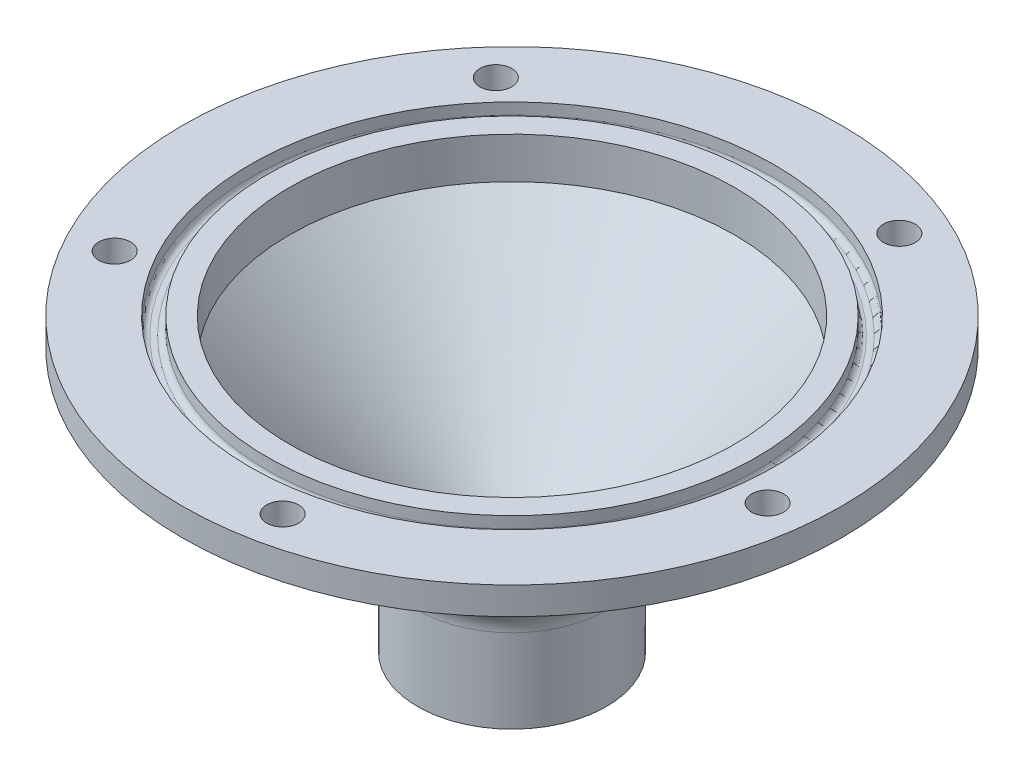
from build123d import *

# Parameters (mm, degrees)
SKETCH2_R          = 1.4732
CUT_EXTRUDE1_DEPTH = 2.54
SKETCH3_R          = 1.4732
CUT_EXTRUDE2_DEPTH = 51.823039515


with BuildPart() as part:
    # Sketch1 → Revolve1 (revolve)
    with BuildSketch(Plane.XY):
        with BuildLine():
            Line((5.55625, 0), (5.55625, 8.100790654))
            Line((5.55625, 8.100790654), (20.574, 23.118540654))
            Line((20.574, 23.118540654), (20.574, 26.924348563))
            Line((20.574, 26.924348563), (22.630430221, 26.924348563))
            Line((22.630430221, 26.924348563), (22.630430221, 25.876598563))
            ThreePointArc((22.630430221, 25.876598563), (22.788519336, 25.494937678), (23.170180221, 25.336848563))
            Line((23.170180221, 25.336848563), (23.678180221, 25.336848563))
            ThreePointArc((23.678180221, 25.336848563), (24.059841106, 25.494937678), (24.217930221, 25.876598563))
            Line((24.217930221, 25.876598563), (24.217930221, 26.924348563))
            Line((24.217930221, 26.924348563), (30.48, 26.924348563))
            Line((30.48, 26.924348563), (30.48, 24.384348563))
            Line((30.48, 24.384348563), (25.4, 24.384348563))
            ThreePointArc((25.4, 24.384348563), (24.184980102, 24.142666079), (23.15493597, 23.454412593))
            Line((23.15493597, 23.454412593), (9.66118597, 9.960662593))
            ThreePointArc((9.66118597, 9.960662593), (8.972932484, 8.930618461), (8.73125, 7.715598563))
            Line((8.73125, 7.715598563), (8.73125, 0))
            Line((8.73125, 0), (5.55625, 0))
        make_face()
    revolve(axis=Axis((0, 0, 0), (0, 1, 0)))

    # Sketch2 → Cut-Extrude1 (cut)
    with BuildSketch(Plane(origin=(0, 26.924348563, 0), x_dir=(1, 0, 0), z_dir=(0, 1, 0))):
        with Locations((-19.816606437, 18.320132793)):
            Circle(SKETCH2_R)
    extrude(amount=-CUT_EXTRUDE1_DEPTH, mode=Mode.SUBTRACT)

    # Sketch3 → Cut-Extrude2 (cut, through all)
    with BuildSketch(Plane(origin=(0, 26.924348563, 0), x_dir=(1, 0, 0), z_dir=(0, 1, 0))):
        with Locations((-23.547149832, -13.185480311)):
            Circle(SKETCH3_R)
        with Locations((5.263667503, -26.469207783)):
            Circle(SKETCH3_R)
        with Locations((26.800275254, -3.173389755)):
            Circle(SKETCH3_R)
        with Locations((11.299813512, 24.507945055)):
            Circle(SKETCH3_R)
    extrude(amount=-CUT_EXTRUDE2_DEPTH, mode=Mode.SUBTRACT)


solid = part.part
